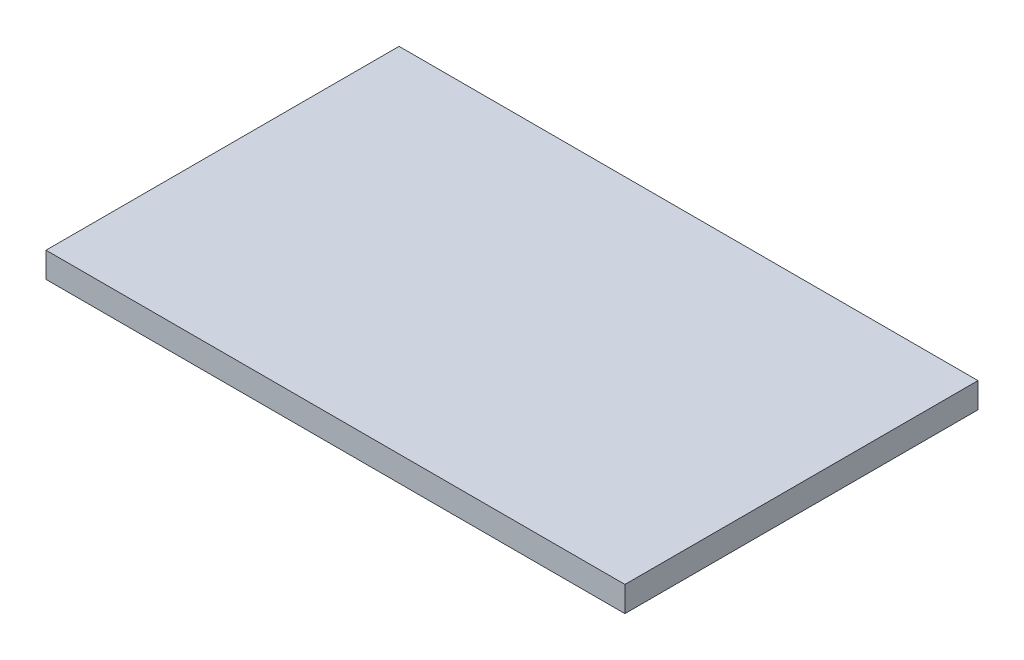
from build123d import *

# Parameters (mm, degrees)
EXTRUDE_3_DEPTH    = 20
ESQUISSE1_W        = 89.2
ESQUISSE1_H        = 54.4
BOSS_EXTRU_1_DEPTH = 3.9
FILLET_1_R         = 0.25


with BuildPart() as part:
    # Эскиз3 → Бобышка-Вытянуть3 (new, symmetric)
    with BuildSketch(Plane.XY):
        with BuildLine():
            Line((-47.815262386, -6.499919999), (-45.841869662, -6.499919999))
            ThreePointArc((-45.841869662, -6.499919999), (-44.821869662, -1.3), (-43.801869662, -6.499919999))
            Line((-43.801869662, -6.499919999), (-41.828476938, -6.499919999))
            ThreePointArc((-41.828476938, -6.499919999), (-44.821869662, -0.1), (-47.815262386, -6.499919999))
        make_face()
    extrude(amount=EXTRUDE_3_DEPTH, both=True)

    # Скругление1
    fillet_1_edges = [part.edges().sort_by_distance(p)[0] for p in [
        (-43.801869662, -6.499919999, 0),
        (-45.841869662, -6.499919999, 0),
    ]]
    fillet(fillet_1_edges, radius=FILLET_1_R)


with BuildPart() as body_2:
    # Esquisse1 → Boss.-Extru.1 (new body)
    with BuildSketch(Plane(origin=(0, 0, 0), x_dir=(1, 0, 0), z_dir=(0, 1, 0))):
        with Locations((1.31, 0)):
            Rectangle(ESQUISSE1_W, ESQUISSE1_H)
    extrude(amount=BOSS_EXTRU_1_DEPTH)


solid = Compound([part.part, body_2.part])
